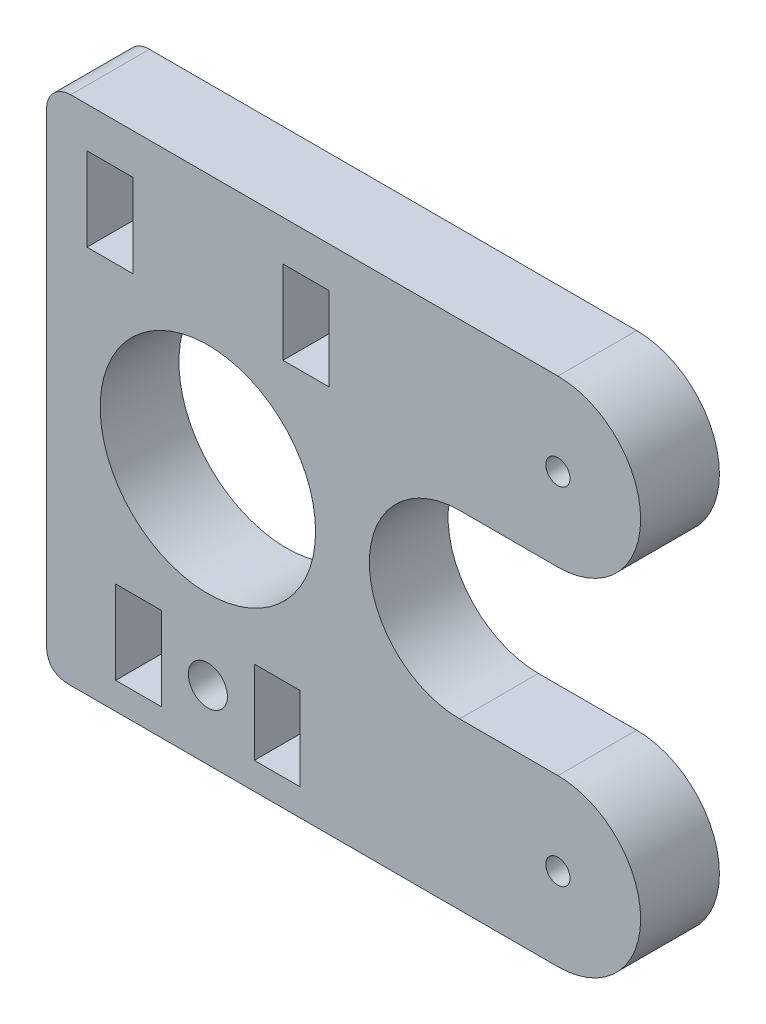
from build123d import *

# Parameters (mm, degrees)
SKETCH1_R           = 0.899918091
SKETCH1_R_2         = 0.899925125
SKETCH1_R_3         = 1.45
SKETCH1_R_4         = 8
SKETCH1_W           = 3.400011
SKETCH1_H           = 6.2
SKETCH1_W_2         = 3.4
BOSS_EXTRUDE2_DEPTH = 5.85


with BuildPart() as part:
    # Sketch1 → Boss-Extrude2 (new body)
    with BuildSketch(Plane.XY):
        with BuildLine():
            Line((669.21684417, 349.76545661), (648.535749201, 349.76545661))
            ThreePointArc((648.535749201, 349.76545661), (647.270566291, 349.24140069), (646.746510371, 347.976217781))
            Line((646.746510371, 347.976217781), (646.746510371, 313.454646051))
            add(Edge.make_bspline(
                [(646.746510371, 313.454646051), (646.746510371, 311.64647079), (648.773268796, 311.76545661)],
                knots=[0, 0, 0, 1, 1, 1], degree=2))
            Line((648.773268796, 311.76545661), (669.21684417, 311.76545661))
            Line((669.21684417, 311.76545661), (684.726521371, 311.76545661))
            ThreePointArc((684.726521371, 311.76545661), (690.873982261, 317.9129175), (684.726521371, 324.06037839))
            Line((684.726521371, 324.06037839), (677.425546339, 324.06037839))
            ThreePointArc((677.425546339, 324.06037839), (670.720468119, 330.76545661), (677.425546339, 337.47053483))
            Line((677.425546339, 337.47053483), (684.726521371, 337.47053483))
            ThreePointArc((684.726521371, 337.47053483), (690.873982261, 343.61799572), (684.726521371, 349.76545661))
            Line((684.726521371, 349.76545661), (669.21684417, 349.76545661))
        make_face()
        with Locations((684.726521371, 343.61799572)):
            Circle(SKETCH1_R, mode=Mode.SUBTRACT)
        with Locations((684.726521371, 317.9129175)):
            Circle(SKETCH1_R_2, mode=Mode.SUBTRACT)
        with Locations((658.726521371, 316.86545661)):
            Circle(SKETCH1_R_3, mode=Mode.SUBTRACT)
        with Locations((658.726521371, 330.76545661)):
            Circle(SKETCH1_R_4, mode=Mode.SUBTRACT)
        with Locations((651.446515871, 343.66545661)):
            Rectangle(SKETCH1_W, SKETCH1_H, mode=Mode.SUBTRACT)
        with Locations((653.576521371, 316.86545661)):
            Rectangle(SKETCH1_W_2, SKETCH1_H, mode=Mode.SUBTRACT)
        with Locations((666.006526871, 343.66545661)):
            Rectangle(SKETCH1_W, SKETCH1_H, mode=Mode.SUBTRACT)
        with Locations((663.876521371, 316.86545661)):
            Rectangle(SKETCH1_W_2, SKETCH1_H, mode=Mode.SUBTRACT)
    extrude(amount=BOSS_EXTRUDE2_DEPTH)


solid = part.part
